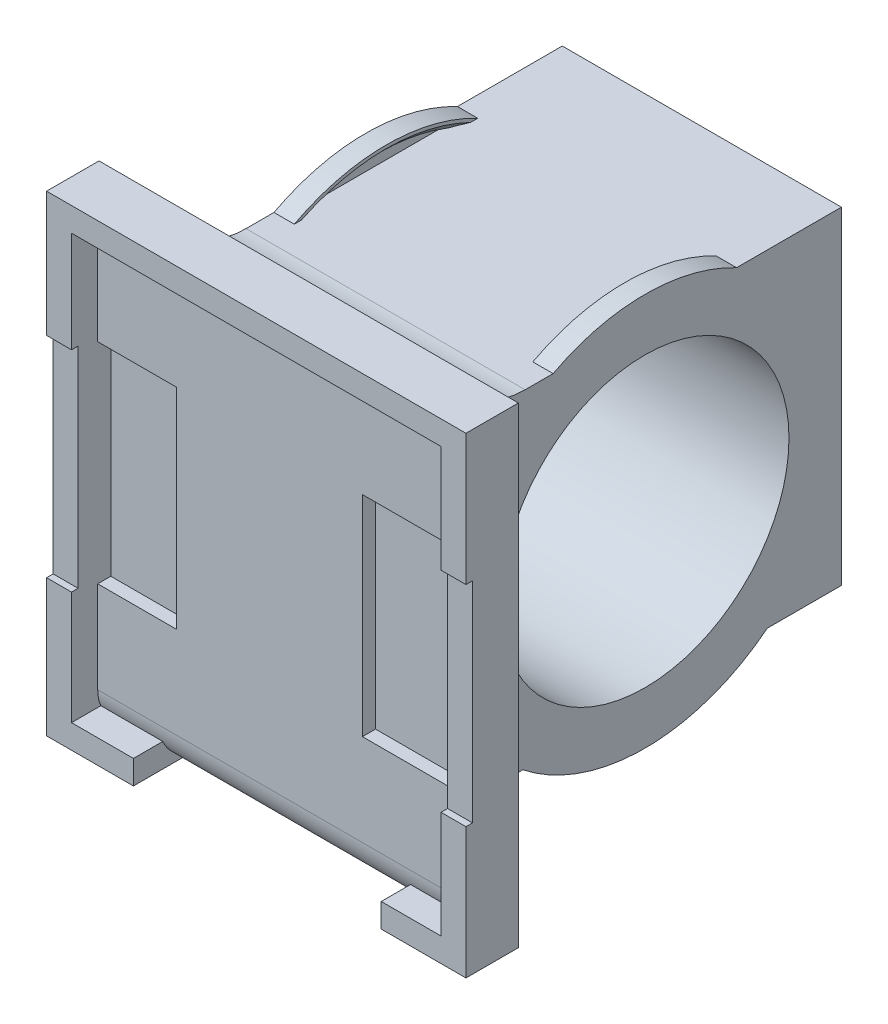
from build123d import *

# Parameters (mm, degrees)
SKETCH6_R                = 15
SKETCH6_R_2              = 11
BOSS_EXTRUDE2_DEPTH      = 21.3
SKETCH4_W                = 19.7
SKETCH4_H                = 3
BOSS_EXTRUDE3_REACH      = 38.107
SKETCH9_W                = 21.3
SKETCH9_H                = 9.16515139
BOSS_EXTRUDE4_START      = 0.75
SKETCH10_R               = 15
SKETCH10_R_2             = 14.25
BOSS_EXTRUDE4_DEPTH      = 0.75
CHAMFER1_SIZE            = 0.5
CHAMFER1_OF_MIRROR1_SIZE = 0.5
BOSS_EXTRUDE6_DEPTH      = 21.3
SKETCH17_W               = 18.5
SKETCH17_H               = 23.6
CUT_EXTRUDE3_DEPTH       = 2
SKETCH14_R               = 11
CUT_EXTRUDE2_DEPTH       = 31.061936082
SKETCH18_W               = 32
SKETCH18_H               = 36
BOSS_EXTRUDE7_DEPTH      = 4
SKETCH19_W               = 28.2
SKETCH19_H               = 32.35
CUT_EXTRUDE4_DEPTH       = 2
SKETCH20_W               = 6
SKETCH20_H               = 16
SKETCH20_W_2             = 8
CUT_EXTRUDE5_DEPTH       = 1
SKETCH21_W               = 1.9
SKETCH21_H               = 16
SKETCH21_H_2             = 16.00994424
CUT_EXTRUDE6_DEPTH       = 0.5
SKETCH22_W               = 18.909915591
SKETCH22_H               = 1.825
CUT_EXTRUDE7_DEPTH       = 2
FILLET1_R                = 6
FILLET2_R                = 3


# Read off the part's stored shape, not the designer's step: Boss-Extrude6
with BuildPart() as part:
    # Sketch6 → Boss-Extrude2 (new body)
    with BuildSketch(Plane(origin=(0, 0, 0), x_dir=(0, 0, -1), z_dir=(1, 0, 0))):
        Circle(SKETCH6_R)
        Circle(SKETCH6_R_2, mode=Mode.SUBTRACT)
    extrude(amount=BOSS_EXTRUDE2_DEPTH)

    # Sketch4 → Cut-Revolve1 (revolve, cut)
    with BuildSketch(Plane.XY, mode=Mode.PRIVATE) as cut_revolve1_sk:
        with Locations((10.65, -13.5)):
            Rectangle(SKETCH4_W, SKETCH4_H)
    revolve(cut_revolve1_sk.sketch.rotate(Axis((-11.602577702, 0, 0), (1, 0, 0)), 270), axis=Axis((-11.602577702, 0, 0), (1, 0, 0)), mode=Mode.SUBTRACT)

    # Sketch9 → Boss-Extrude3 (add, up to next)
    with BuildSketch(Plane.XY.offset(-10), mode=Mode.PRIVATE) as boss_extrude3_sk1:
        with Locations((10.65, 0)):
            Rectangle(SKETCH9_W, SKETCH9_H)
    boss_extrude3_tool1 = extrude(boss_extrude3_sk1.sketch, amount=-BOSS_EXTRUDE3_REACH, mode=Mode.PRIVATE) - part.part
    add(boss_extrude3_tool1.solids().sort_by_distance((10.65, 0, -10))[0])

    # Sketch10 → Boss-Extrude4 (add)
    with BuildSketch(Plane.ZY.offset(-20.5).offset(BOSS_EXTRUDE4_START)):
        Circle(SKETCH10_R)
        Circle(SKETCH10_R_2, mode=Mode.SUBTRACT)
    boss_extrude4 = extrude(amount=-BOSS_EXTRUDE4_DEPTH)

    # Chamfer1
    chamfer1_edges = [part.edges().sort_by_distance(p)[0] for p in [
        (19.75, 0, -14.25),
    ]]
    chamfer(chamfer1_edges, length=CHAMFER1_SIZE)

    # Mirror1: Boss-Extrude4 across plane
    add(boss_extrude4.mirror(Plane.ZY.offset(-10.65)))

    # Chamfer1 of Mirror1
    chamfer1_of_mirror1_edges = [part.edges().sort_by_distance(p)[0] for p in [
        (1.55, 0, -14.25),
    ]]
    chamfer(chamfer1_of_mirror1_edges, length=CHAMFER1_OF_MIRROR1_SIZE)

    # Boss-Extrude6 outline → Boss-Extrude6 (add)
    with BuildSketch(Plane.YZ):
        with BuildLine():
            Line((13.266430469, -15), (13.266430469, 15.001))
            Line((13.266430469, 15.001), (-11.733569531, 15.001))
            Line((-11.733569531, 15.001), (-11.733569531, 2.514626428))
            ThreePointArc((-11.733569531, 2.514626428), (12, 0), (-11.733569531, -2.514626428))
            Line((-11.733569531, -2.514626428), (-11.733569531, -15))
            Line((-11.733569531, -15), (13.266430469, -15))
        make_face()
    extrude(amount=BOSS_EXTRUDE6_DEPTH)

    # Sketch17 → Cut-Extrude3 (cut)
    with BuildSketch(Plane(origin=(0, 0, -15), x_dir=(-1, 0, 0), z_dir=(0, 0, -1))):
        with Locations((-10.65, 0.066430469)):
            Rectangle(SKETCH17_W, SKETCH17_H)
    extrude(amount=-CUT_EXTRUDE3_DEPTH, mode=Mode.SUBTRACT)

    # Sketch14 → Cut-Extrude2 (cut, through all)
    with BuildSketch(Plane(origin=(21.3, 0, 0), x_dir=(0, 0, -1), z_dir=(1, 0, 0))):
        Circle(SKETCH14_R)
    extrude(amount=-CUT_EXTRUDE2_DEPTH, mode=Mode.SUBTRACT)

    # Sketch18 → Boss-Extrude7 (add)
    with BuildSketch(Plane.XY.offset(15.001)):
        with Locations((10.65, 0)):
            Rectangle(SKETCH18_W, SKETCH18_H)
    extrude(amount=BOSS_EXTRUDE7_DEPTH)

    # Sketch19 → Cut-Extrude4 (cut)
    with BuildSketch(Plane.XY.offset(19.001)):
        with Locations((10.65, 0)):
            Rectangle(SKETCH19_W, SKETCH19_H)
    extrude(amount=-CUT_EXTRUDE4_DEPTH, mode=Mode.SUBTRACT)

    # Sketch20 → Cut-Extrude5 (cut)
    with BuildSketch(Plane.XY.offset(17.001)):
        with Locations((-0.45, 0)):
            Rectangle(SKETCH20_W, SKETCH20_H)
        with Locations((20.75, 0)):
            Rectangle(SKETCH20_W_2, SKETCH20_H)
    extrude(amount=-CUT_EXTRUDE5_DEPTH, mode=Mode.SUBTRACT)

    # Sketch21 → Cut-Extrude6 (cut)
    with BuildSketch(Plane.XY.offset(19.001)):
        with Locations((25.7, 0)):
            Rectangle(SKETCH21_W, SKETCH21_H)
        with Locations((-4.4, 0.459988306)):
            Rectangle(SKETCH21_W, SKETCH21_H_2)
    extrude(amount=-CUT_EXTRUDE6_DEPTH, mode=Mode.SUBTRACT)

    # Sketch22 → Cut-Extrude7 (cut)
    with BuildSketch(Plane.XY.offset(19.001)):
        with Locations((10.730756322, -17.0875)):
            Rectangle(SKETCH22_W, SKETCH22_H)
    extrude(amount=-CUT_EXTRUDE7_DEPTH, mode=Mode.SUBTRACT)

    # Fillet1
    # the kernel refuses this fillet: 6 mm, written as the material it adds along each edge
    with BuildSketch(Plane(origin=(0, -11.733569531, 15.001), x_dir=(0, -1, 0), z_dir=(1, 0, 0))) as fillet1_piece_1:
        with BuildLine():
            CenterArc((FILLET1_R, FILLET1_R), FILLET1_R, 180, 90)
            Line((0, FILLET1_R), (-FILLET1_R * 0.02, FILLET1_R))
            Line((-FILLET1_R * 0.02, FILLET1_R), (-FILLET1_R * 0.02, -FILLET1_R * 0.02))
            Line((-FILLET1_R * 0.02, -FILLET1_R * 0.02), (FILLET1_R, -FILLET1_R * 0.02))
            Line((FILLET1_R, -FILLET1_R * 0.02), (FILLET1_R, 0))
        make_face()
    extrude(amount=21.3)
    with BuildSketch(Plane(origin=(0, 13.266430469, 15.001), x_dir=(0, 1, 0), z_dir=(1, 0, 0))) as fillet1_piece_2:
        with BuildLine():
            CenterArc((6, -5.86482343), FILLET1_R, 102.185166617, 77.814833383)
            Line((0, -5.86482343), (-0.12, -5.86482343))
            Line((-0.12, -5.86482343), (-0.12, 0))
            Line((-0.12, 0), (0, 0.12))
            ThreePointArc((0, 0.12), (2.366784766, 0.12), (4.708240922, 0.117296469))
            Line((4.708240922, 0.117296469), (4.733569531, 0))
        make_face()
    extrude(amount=21.3)

    # Fillet2
    # the kernel refuses this fillet: 3 mm, written as the material it takes off along each edge
    with BuildSketch(Plane(origin=(1.4, -11.733569531, -13), x_dir=(0, -1.6111438109570978e-10, 1.0), z_dir=(1, 0, 0))) as fillet2_piece_1:
        with BuildLine():
            CenterArc((FILLET2_R, -FILLET2_R), FILLET2_R, 89.999999991, 90)
            Line((-FILLET2_R * 1.6111438107e-10, -FILLET2_R), (0, 0))
            Line((0, 0), (FILLET2_R, 0))
        make_face()
    extrude(amount=18.5, mode=Mode.SUBTRACT)
    with BuildSketch(Plane(origin=(27.685714118, -18, 17.001), x_dir=(0, 0, -1), z_dir=(-1, 0, 0))) as fillet2_piece_2_section:
        with BuildLine():
            CenterArc((FILLET2_R, -FILLET2_R), FILLET2_R, 90, 90)
            Line((0, -FILLET2_R), (0, 0))
            Line((0, 0), (FILLET2_R, 0))
        make_face()
    fillet2_piece_2 = extrude(amount=33.90991559, mode=Mode.PRIVATE)
    fillet2_piece_2 = split(fillet2_piece_2, bisect_by=Plane(origin=(22.467857059, -16.175, 16.929617158), z_dir=(0, 1, 0)), keep=Keep.TOP, mode=Mode.PRIVATE)
    fillet2_piece_2 = split(fillet2_piece_2, bisect_by=Plane(origin=(24.75, -15.883648186, 16.929617158), z_dir=(-1, 0, 0)), keep=Keep.TOP, mode=Mode.PRIVATE)
    fillet2_piece_2 = split(fillet2_piece_2, bisect_by=Plane(origin=(-3.45, -15.883648186, 16.929617158), z_dir=(1, 0, 0)), keep=Keep.TOP, mode=Mode.PRIVATE)
    add(fillet2_piece_2, mode=Mode.SUBTRACT)
    with BuildSketch(Plane(origin=(20.185714118, -18, 17.001), x_dir=(0, 0, -1), z_dir=(-1, 0, 0))) as fillet2_piece_3:
        with BuildLine():
            CenterArc((FILLET2_R, -FILLET2_R), FILLET2_R, 90, 90)
            Line((0, -FILLET2_R), (0, 0))
            Line((0, 0), (FILLET2_R, 0))
        make_face()
    extrude(amount=18.90991559, mode=Mode.SUBTRACT)


solid = part.part
